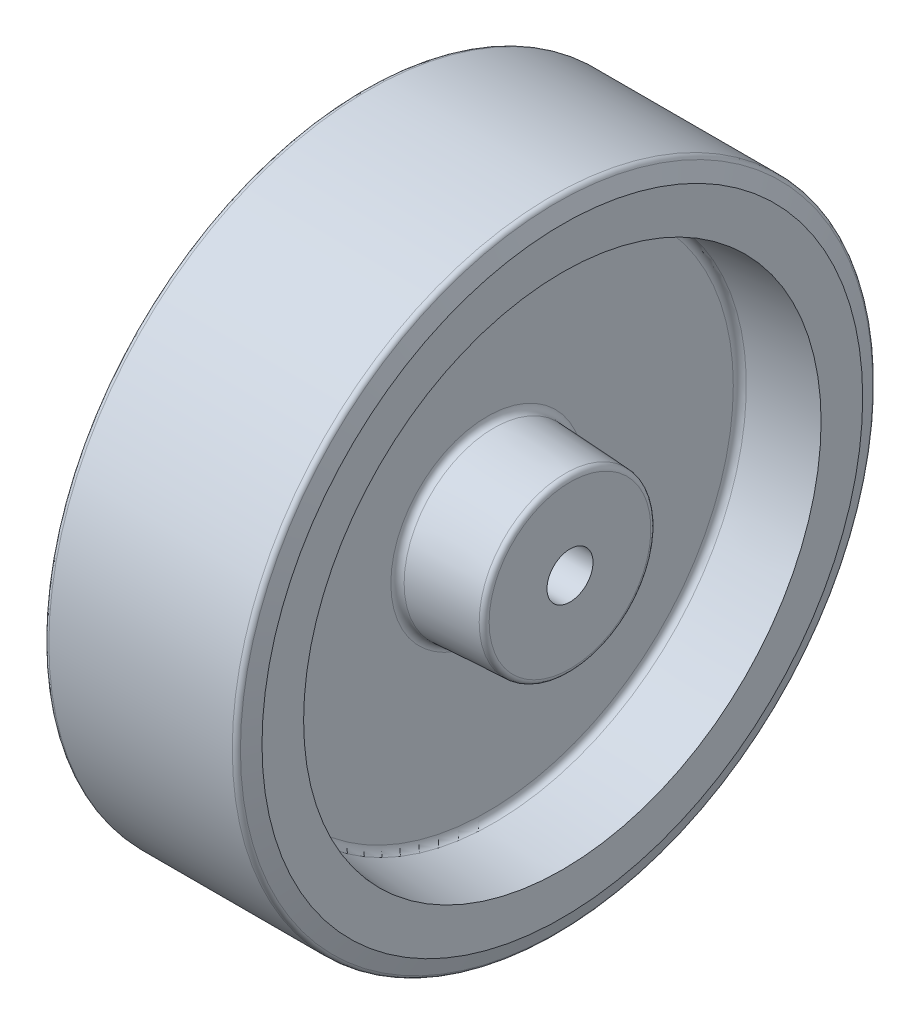
from build123d import *


with BuildPart() as part:
    # Schizzo1 → Rivoluzione1 (revolve)
    with BuildSketch(Plane.XY):
        with BuildLine():
            Line((-43, 9), (43, 9))
            Line((43, 9), (43, 31.64))
            ThreePointArc((43, 31.64), (42.450748742, 33.016709151), (41.104671912, 33.63725907))
            Line((41.104671912, 33.63725907), (13.200262997, 35.099667173))
            ThreePointArc((13.200262997, 35.099667173), (11.403250429, 35.928101314), (10.67, 37.766008031))
            Line((10.67, 37.766008031), (10.67, 96.207880322))
            ThreePointArc((10.67, 96.207880322), (11.371469511, 98.011706176), (13.107294167, 98.867720166))
            Line((13.107294167, 98.867720166), (40, 101.220527058))
            Line((40, 101.220527058), (40, 117.500527058))
            Line((40, 117.500527058), (37.749385242, 123.684040287))
            ThreePointArc((37.749385242, 123.684040287), (37.017152873, 124.638304089), (35.87, 125))
            Line((35.87, 125), (-35.87, 125))
            ThreePointArc((-35.87, 125), (-37.017152873, 124.638304089), (-37.749385242, 123.684040287))
            Line((-37.749385242, 123.684040287), (-40, 117.500527058))
            Line((-40, 117.500527058), (-40, 101.220527058))
            Line((-40, 101.220527058), (-13.107294167, 98.867720166))
            ThreePointArc((-13.107294167, 98.867720166), (-11.371469511, 98.011706176), (-10.67, 96.207880322))
            Line((-10.67, 96.207880322), (-10.67, 37.766008031))
            ThreePointArc((-10.67, 37.766008031), (-11.403250429, 35.928101314), (-13.200262997, 35.099667173))
            Line((-13.200262997, 35.099667173), (-41.104671912, 33.63725907))
            ThreePointArc((-41.104671912, 33.63725907), (-42.450748742, 33.016709151), (-43, 31.64))
            Line((-43, 31.64), (-43, 9))
        make_face()
    revolve(axis=Axis((-469.674938733, 0, 0), (1, 0, 0)))


solid = part.part
